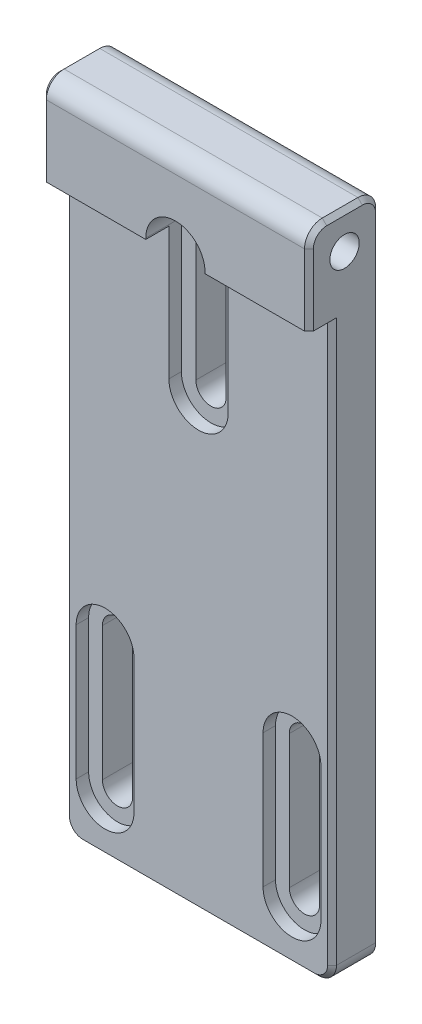
from build123d import *

# Parameters (mm, degrees)
SKETCH1_W           = 30
SKETCH1_H           = 80
BOSS_EXTRUDE1_DEPTH = 8
CUT_EXTRUDE1_DEPTH  = 44.462627624
CUT_EXTRUDE2_DEPTH  = 4
CUT_EXTRUDE3_DEPTH  = 32
CUT_EXTRUDE4_DEPTH  = 4
SKETCH8_W           = 2.6
SKETCH8_H           = 70
CUT_EXTRUDE5_DEPTH  = 73
FILLET1_R           = 2
FILLET2_R           = 2
CHAMFER1_SIZE       = 0.5
CUT_EXTRUDE7_DEPTH  = 1
SKETCH10_W          = 41.633807812
SKETCH10_H          = 5
CUT_EXTRUDE8_DEPTH  = 10
FILLET3_R           = 2
CHAMFER2_SIZE       = 0.5


with BuildPart() as part:
    # Sketch1 → Boss-Extrude1 (new body)
    with BuildSketch(Plane.XY):
        Rectangle(SKETCH1_W, SKETCH1_H)
    extrude(amount=BOSS_EXTRUDE1_DEPTH)

    # Sketch3 → M4 Tapped Hole1 (revolve, cut)
    with BuildSketch(Plane(origin=(-15, 36, 4), x_dir=(0, 0, 1), z_dir=(0, 1, 0))):
        Polygon((0, 0), (0, 12.491420021), (1.65, 11.5), (1.65, 0), align=None)
    m4_tapped_hole1 = revolve(axis=Axis((-21.35, 36, 4), (1, 0, 0)), mode=Mode.SUBTRACT)

    # Mirror1: M4 Tapped Hole1 across plane
    add(m4_tapped_hole1.mirror(Plane.ZY), mode=Mode.SUBTRACT)

    # Sketch4 → Cut-Extrude1 (cut, through all)
    with BuildSketch(Plane(origin=(0, 0, 0), x_dir=(-1, 0, 0), z_dir=(0, 0, -1))):
        with BuildLine():
            Line((-8.8, -14), (-8.8, -29))
            ThreePointArc((-8.8, -29), (-10.5, -30.7), (-12.2, -29))
            Line((-12.2, -29), (-12.2, -14))
            ThreePointArc((-12.2, -14), (-10.5, -12.3), (-8.8, -14))
        make_face()
        with BuildLine():
            Line((8.8, -14), (8.8, -29))
            ThreePointArc((8.8, -29), (10.5, -30.7), (12.2, -29))
            Line((12.2, -29), (12.2, -14))
            ThreePointArc((12.2, -14), (10.5, -12.3), (8.8, -14))
        make_face()
    extrude(amount=-CUT_EXTRUDE1_DEPTH, mode=Mode.SUBTRACT)

    # Sketch5 → Cut-Extrude2 (cut)
    with BuildSketch(Plane.XY.offset(8)):
        with BuildLine():
            Line((-7.25, -14), (-7.25, -29))
            ThreePointArc((-7.25, -29), (-10.5, -32.25), (-13.75, -29))
            Line((-13.75, -29), (-13.75, -14))
            ThreePointArc((-13.75, -14), (-10.5, -10.75), (-7.25, -14))
        make_face()
        with BuildLine():
            Line((7.25, -14), (7.25, -29))
            ThreePointArc((7.25, -29), (10.5, -32.25), (13.75, -29))
            Line((13.75, -29), (13.75, -14))
            ThreePointArc((13.75, -14), (10.5, -10.75), (7.25, -14))
        make_face()
    extrude(amount=-CUT_EXTRUDE2_DEPTH, mode=Mode.SUBTRACT)

    # Sketch6 → Cut-Extrude3 (cut)
    with BuildSketch(Plane.XY.offset(8)):
        with BuildLine():
            Line((1.7, 30.14), (1.7, 15.14))
            ThreePointArc((1.7, 15.14), (0, 13.44), (-1.7, 15.14))
            Line((-1.7, 15.14), (-1.7, 30.14))
            ThreePointArc((-1.7, 30.14), (0, 31.84), (1.7, 30.14))
        make_face()
    extrude(amount=-CUT_EXTRUDE3_DEPTH, mode=Mode.SUBTRACT)

    # Sketch7 → Cut-Extrude4 (cut)
    with BuildSketch(Plane.XY.offset(8)):
        with BuildLine():
            Line((3.329829484, 30.14), (3.329829484, 15.14))
            ThreePointArc((3.329829484, 15.14), (0, 11.810170516), (-3.329829484, 15.14))
            Line((-3.329829484, 15.14), (-3.329829484, 30.14))
            ThreePointArc((-3.329829484, 30.14), (0, 33.469829484), (3.329829484, 30.14))
        make_face()
    extrude(amount=-CUT_EXTRUDE4_DEPTH, mode=Mode.SUBTRACT)

    # Sketch8 → Cut-Extrude5 (cut)
    with BuildSketch(Plane.ZY.offset(15)):
        with Locations((6.7, -5)):
            Rectangle(SKETCH8_W, SKETCH8_H)
    extrude(amount=-CUT_EXTRUDE5_DEPTH, mode=Mode.SUBTRACT)

    # Fillet1
    fillet1_edges = [part.edges().sort_by_distance(p)[0] for p in [
        (0, 40, 0),
        (0, 40, 8),
    ]]
    fillet(fillet1_edges, radius=FILLET1_R)

    # Fillet2
    fillet2_edges = [part.edges().sort_by_distance(p)[0] for p in [
        (15, -40, 2.7),
        (-15, -40, 2.7),
    ]]
    fillet(fillet2_edges, radius=FILLET2_R)

    # Chamfer1
    chamfer1_edges = [part.edges().sort_by_distance(p)[0] for p in [
        (15, 34, 8),
        (15, -4, 5.4),
        (-15, -4, 5.4),
        (-15, 34, 8),
        (-15, 40, 4),
        (-15, 0, 0),
        (-15, 39.414213562, 0.585786438),
        (-15, 39.414213562, 7.414213562),
        (15, 40, 4),
        (15, 39.414213562, 0.585786438),
        (15, 39.414213562, 7.414213562),
        (0, -40, 5.4),
        (0, -40, 0),
        (15, 0, 0),
        (14.414213562, -39.414213562, 0),
        (-14.414213562, -39.414213562, 0),
        (14.414213562, -39.414213562, 5.4),
        (-14.414213562, -39.414213562, 5.4),
    ]]
    chamfer(chamfer1_edges, length=CHAMFER1_SIZE)

    # Sketch9 → Cut-Extrude7 (cut)
    with BuildSketch(Plane(origin=(0, 0, 0), x_dir=(-1, 0, 0), z_dir=(0, 0, -1))):
        with BuildLine():
            Line((-5, -40), (5, -40))
            Line((5, -40), (5, -22.5))
            ThreePointArc((5, -22.5), (4.560660172, -21.439339828), (3.5, -21))
            Line((3.5, -21), (-3.5, -21))
            ThreePointArc((-3.5, -21), (-4.560660172, -21.439339828), (-5, -22.5))
            Line((-5, -22.5), (-5, -40))
        make_face()
    extrude(amount=-CUT_EXTRUDE7_DEPTH, mode=Mode.SUBTRACT)

    # Sketch10 → Cut-Extrude8 (cut)
    with BuildSketch(Plane.XY.offset(5.4)):
        with Locations((0.581549675, -37.5)):
            Rectangle(SKETCH10_W, SKETCH10_H)
    extrude(amount=-CUT_EXTRUDE8_DEPTH, mode=Mode.SUBTRACT)

    # Fillet3
    fillet3_edges = [part.edges().sort_by_distance(p)[0] for p in [
        (15, -35, 2.7),
        (-15, -35, 2.7),
    ]]
    fillet(fillet3_edges, radius=FILLET3_R)

    # Chamfer2
    chamfer2_edges = [part.edges().sort_by_distance(p)[0] for p in [
        (13.822875656, -34.822875656, 0),
        (9, -35, 0),
        (13.822875656, -34.822875656, 5.4),
        (-13.822875656, -34.822875656, 5.4),
        (0, -35, 5.4),
        (-13.822875656, -34.822875656, 0),
        (-9, -35, 0),
    ]]
    chamfer(chamfer2_edges, length=CHAMFER2_SIZE - 0.0001)  # a hair under: the kernel refuses the full size


solid = part.part
